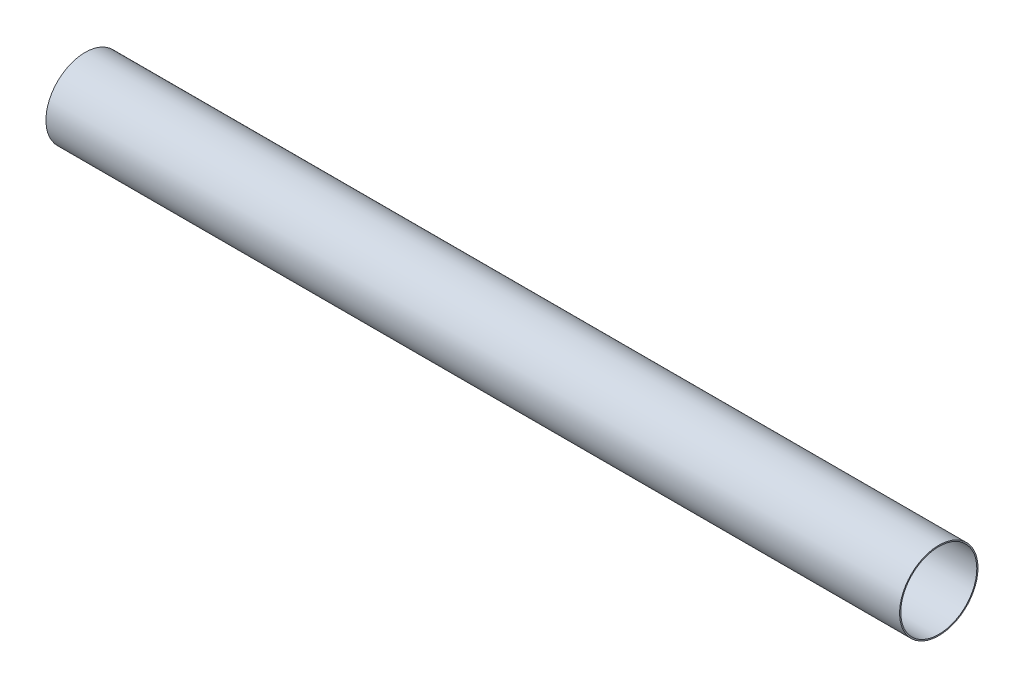
from build123d import *

# Parameters (mm, degrees)
SKETCH1_R           = 26.19375
SKETCH1_R_2         = 25.4
BOSS_EXTRUDE1_DEPTH = 285.115


with BuildPart() as part:
    # Sketch1 → Boss-Extrude1 (new, symmetric)
    with BuildSketch(Plane(origin=(0, 0, 0), x_dir=(0, 0, -1), z_dir=(1, 0, 0))):
        Circle(SKETCH1_R)
        Circle(SKETCH1_R_2, mode=Mode.SUBTRACT)
    extrude(amount=BOSS_EXTRUDE1_DEPTH, both=True)


solid = part.part
